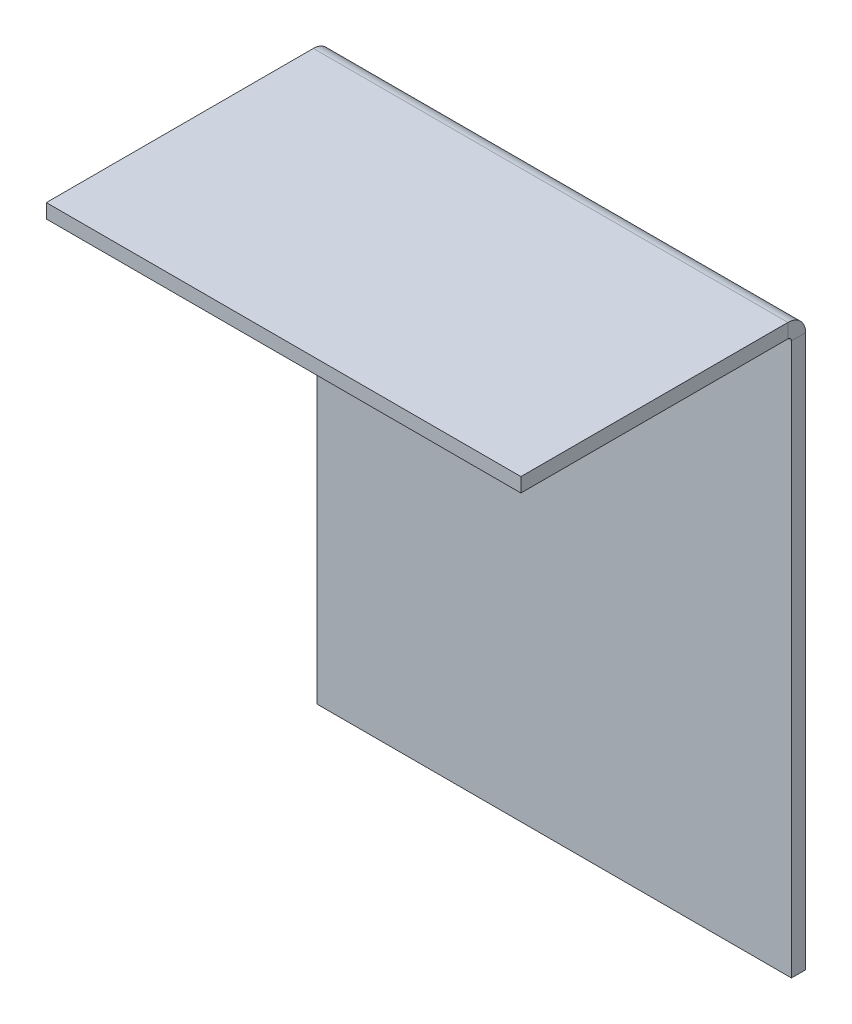
from build123d import *

# Parameters (mm, degrees)
SKETCH_1_W                       = 100
SKETCH_1_H                       = 120
SM_BASE_FLANGE_1_DEPTH           = 3
SM_EDGE_FLANGE_1_STRIP_W         = 13.4732
SM_EDGE_FLANGE_1_STRIP_H         = 3
SM_EDGE_FLANGE_1_STRIP_CUT_DEPTH = 100
SM_EDGE_FLANGE_1_DEPTH           = 100


# Sheet-metal steps are written as plain solids
with BuildPart() as part:
    # Sketch 1 → 基体-法兰1 (new body)
    with BuildSketch(Plane.XY):
        Rectangle(SKETCH_1_W, SKETCH_1_H)
    extrude(amount=-SM_BASE_FLANGE_1_DEPTH)

    # 边线-法兰1 strip (across the edge) → 边线-法兰1 strip cut (cut)
    with BuildSketch(Plane(origin=(50, 60, 0), x_dir=(0, -1, 0), z_dir=(-1, 0, 0))):
        with Locations((-3, -1.5)):
            Rectangle(SM_EDGE_FLANGE_1_STRIP_W, SM_EDGE_FLANGE_1_STRIP_H)
    extrude(amount=SM_EDGE_FLANGE_1_STRIP_CUT_DEPTH, mode=Mode.SUBTRACT)

    # 边线-法兰1 section (across the edge) → 边线-法兰1 (add)
    with BuildSketch(Plane(origin=(50, 60, 0), x_dir=(0, -1, 0), z_dir=(-1, 0, 0))):
        with BuildLine():
            Line((0, 0.7366), (0, 57))
            Line((0, 57), (3, 57))
            Line((3, 57), (3, 0.7366))
            ThreePointArc((3, 0.7366), (3.215745145, 0.215745145), (3.7366, 0))
            Line((3.7366, 0), (3.7366, -3))
            ThreePointArc((3.7366, -3), (1.094424801, -1.905575199), (0, 0.7366))
        make_face()
    extrude(amount=SM_EDGE_FLANGE_1_DEPTH)


solid = part.part
